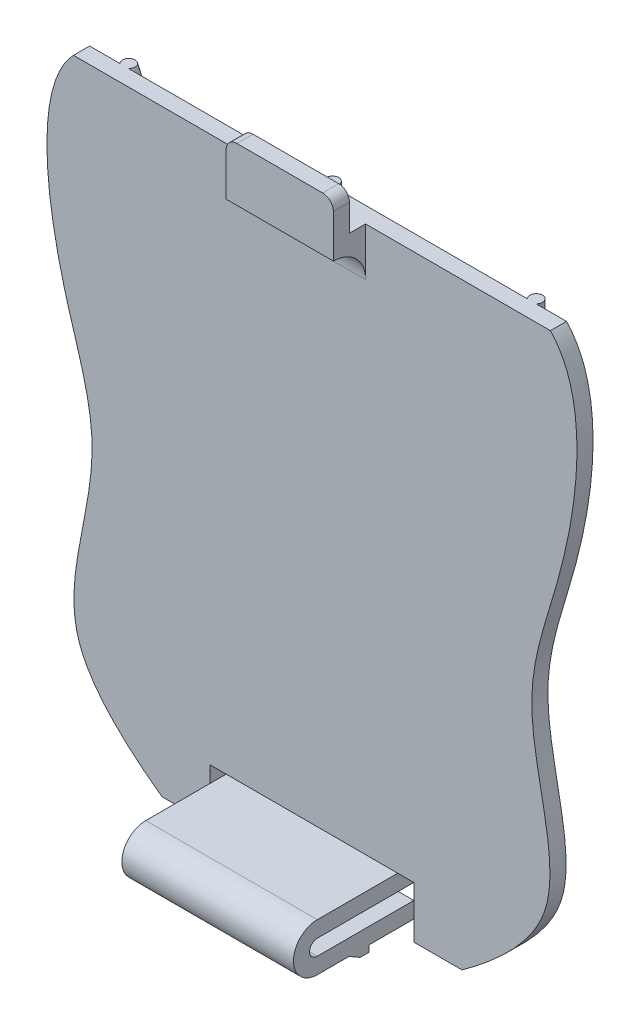
from build123d import *

# Parameters (mm, degrees)
LOW_PLATE_DEPTH     = 1.5
SKETCH3_W           = 19
SKETCH3_H           = 4.817001744
CUT_EXTRUDE1_DEPTH  = 62.000496717
SKETCH5_W           = 9
SKETCH5_H           = 1.5
TONGUE_DEPTH        = 8
TONGUE_BUTTON_DEPTH = 1.5
SKETCH7_W           = 4.5
SKETCH7_H           = 1.5
SKETCH7_W_2         = 1.5
SKETCH7_H_2         = 3.5
BOSS_EXTRUDE4_DEPTH = 5
SKETCH8_W           = 3
SKETCH8_H           = 6.224279684
CUT_EXTRUDE2_DEPTH  = 30
FILLET_START        = -5
FILLET_3MM_DEPTH    = 10
FILLET2_R           = 1
SKETCH9_W           = 0.8
SKETCH9_H           = 0.6
RIGHT_CLIPS_DEPTH   = 2
CLIPS_RIBBS_DEPTH   = 4.5
BOSS_EXTRUDE7_DEPTH = 47
BOSS_EXTRUDE8_DEPTH = 45


with BuildPart() as part:
    # Sketch2 → Low Plate (new body)
    with BuildSketch(Plane.XY):
        with BuildLine():
            Line((-13.987410865, -55.75), (13.987410865, -55.75))
            add(Edge.make_bspline(
                [(13.987410865, -55.75), (15.364516245, -54.752908861), (16.692982198, -53.699471161), (18.526440715, -51.934841851), (19.113479504, -51.311981088), (20.183935625, -49.995249875), (20.669689967, -49.301399402), (21.278190693, -48.174460264), (21.458830968, -47.786634264), (21.758862818, -46.996665666), (21.877700551, -46.592093962), (22.0559056, -45.764663188), (22.116243051, -45.339154605), (22.18748451, -44.490693409), (22.199011375, -44.067536932), (22.180829682, -42.800419677), (22.099164736, -41.95877515), (21.868374402, -40.278493527), (21.718690582, -39.440313431), (21.244394379, -36.929561866), (20.892566631, -35.2590388), (20.577091845, -32.733527124), (20.507236183, -31.888409042), (20.492208023, -30.186585415), (20.552200399, -29.32939987), (20.73057206, -28.035407647), (20.804521311, -27.602881393), (20.974351767, -26.745434183), (21.070391606, -26.319097363), (21.382998298, -25.045340626), (21.623934502, -24.203149153), (22.12390442, -22.522649028), (22.38274515, -21.684298971), (22.877329959, -20.00264347), (23.11123752, -19.158944002), (23.749184146, -16.614162445), (24.099040974, -14.901455558), (24.470243393, -12.299444034), (24.567983481, -11.426529836), (24.695738389, -9.666170984), (24.725628098, -8.777896383), (24.691148458, -7.011699611), (24.627815746, -6.130667368), (24.361532714, -4.37486133), (24.161716694, -3.515589704), (23.779971484, -2.48158604), (23.696844615, -2.27680486), (23.514880537, -1.871923627), (23.415633783, -1.67119118), (23.09590805, -1.087082658), (22.852605055, -0.719048656), (22.29268626, -0.03494376), (21.970988856, 0.282090082), (21.279235232, 0.833537602), (20.908488239, 1.073605964), (20.130319718, 1.501163849), (19.724550492, 1.687333637), (18.906439227, 2.013968076), (18.491193707, 2.15589155), (17.232489601, 2.536842993), (16.376307609, 2.731895799), (14.647046711, 3.063601594), (13.773968133, 3.199405493), (12.024016772, 3.447140862), (11.146413812, 3.558864437), (8.515107441, 3.900980238), (6.762049959, 4.134358142), (4.175193681, 4.681936146), (3.320114283, 4.897770661), (1.63583587, 5.449066892), (0.806320369, 5.783065718), (0, 6.224279684)],
                knots=[0, 0, 0, 0, 0.0625, 0.0625, 0.09375, 0.09375, 0.125, 0.125, 0.140625, 0.140625, 0.15625, 0.15625, 0.171875, 0.171875, 0.1875, 0.1875, 0.21875, 0.21875, 0.25, 0.25, 0.3125, 0.3125, 0.34375, 0.34375, 0.375, 0.375, 0.390625, 0.390625, 0.40625, 0.40625, 0.4375, 0.4375, 0.46875, 0.46875, 0.5, 0.5, 0.5625, 0.5625, 0.59375, 0.59375, 0.625, 0.625, 0.65625, 0.65625, 0.6875, 0.6875, 0.6953125, 0.6953125, 0.703125, 0.703125, 0.71875, 0.71875, 0.734375, 0.734375, 0.75, 0.75, 0.765625, 0.765625, 0.78125, 0.78125, 0.8125, 0.8125, 0.84375, 0.84375, 0.875, 0.875, 0.9375, 0.9375, 0.96875, 0.96875, 1, 1, 1, 1], degree=3))
            add(Edge.make_bspline(
                [(0, 6.224279684), (-0.78781572, 5.793191358), (-1.59969269, 5.463688393), (-3.250288628, 4.918007999), (-4.089304063, 4.70308224), (-6.629712981, 4.156940709), (-8.354084583, 3.922737374), (-11.807066612, 3.47222681), (-13.536628271, 3.263046491), (-16.100537752, 2.790086115), (-16.950076528, 2.605735334), (-18.20851631, 2.246104635), (-18.626112374, 2.111737043), (-19.442777675, 1.806644848), (-19.842917847, 1.635776182), (-20.620162533, 1.242519333), (-21.000449987, 1.017788231), (-21.707807481, 0.508371536), (-22.034629769, 0.223449612), (-22.477316066, -0.257423908), (-22.617930469, -0.427196518), (-22.88094555, -0.778522223), (-23.003096797, -0.959483365), (-23.34478427, -1.516391451), (-23.539706693, -1.906276719), (-23.876874208, -2.715877414), (-24.01675437, -3.130154085), (-24.250726219, -3.965689427), (-24.345271274, -4.388340996), (-24.498951121, -5.241350614), (-24.558027347, -5.671721409), (-24.646972495, -6.538819504), (-24.676663881, -6.974981428), (-24.728611977, -8.275225371), (-24.714946447, -9.137184148), (-24.619449188, -10.854227556), (-24.537274438, -11.709277595), (-24.210555404, -14.266340556), (-23.887407569, -15.960234373), (-23.285495324, -18.489850781), (-23.064178692, -19.331692339), (-22.584933476, -21.012960688), (-22.328473597, -21.85248435), (-21.568336586, -24.371664938), (-21.076070946, -26.052074517), (-20.636971825, -28.592429374), (-20.540245663, -29.442488379), (-20.47902807, -31.15132802), (-20.518239419, -32.010352874), (-20.773645661, -34.596514295), (-21.124722079, -36.332547063), (-21.625125581, -38.934867442), (-21.787706997, -39.802029252), (-22.049361302, -41.532164124), (-22.149215918, -42.396061281), (-22.216131051, -44.124939117), (-22.184303618, -44.989402765), (-21.99208071, -46.070040071), (-21.945610298, -46.286779492), (-21.837202033, -46.711410531), (-21.775071919, -46.920258695), (-21.564469479, -47.536211191), (-21.392786311, -47.933161545), (-20.803562128, -49.091563627), (-20.307916123, -49.825604486), (-19.226630089, -51.186589759), (-18.637007111, -51.821294758), (-17.393865498, -53.030973568), (-16.738818031, -53.606341253), (-15.388299543, -54.710635735), (-14.694077635, -55.238338957), (-13.987410865, -55.75)],
                knots=[0, 0, 0, 0, 0.03125, 0.03125, 0.0625, 0.0625, 0.125, 0.125, 0.1875, 0.1875, 0.21875, 0.21875, 0.234375, 0.234375, 0.25, 0.25, 0.265625, 0.265625, 0.28125, 0.28125, 0.2890625, 0.2890625, 0.296875, 0.296875, 0.3125, 0.3125, 0.328125, 0.328125, 0.34375, 0.34375, 0.359375, 0.359375, 0.375, 0.375, 0.40625, 0.40625, 0.4375, 0.4375, 0.5, 0.5, 0.53125, 0.53125, 0.5625, 0.5625, 0.625, 0.625, 0.65625, 0.65625, 0.6875, 0.6875, 0.75, 0.75, 0.78125, 0.78125, 0.8125, 0.8125, 0.84375, 0.84375, 0.8515625, 0.8515625, 0.859375, 0.859375, 0.875, 0.875, 0.90625, 0.90625, 0.9375, 0.9375, 0.96875, 0.96875, 1, 1, 1, 1], degree=3))
        make_face()
    extrude(amount=LOW_PLATE_DEPTH)

    # Sketch3 → Cut-Extrude1 (cut, through all)
    with BuildSketch(Plane.XY.offset(1.5)):
        with Locations((0, -53.341499128)):
            Rectangle(SKETCH3_W, SKETCH3_H)
    extrude(amount=-CUT_EXTRUDE1_DEPTH, mode=Mode.SUBTRACT)

    # Sketch5 → Tongue (add, symmetric)
    with BuildSketch(Plane(origin=(0, 0, 0), x_dir=(0, 0, -1), z_dir=(1, 0, 0))):
        with Locations((-4.5, -51.682998256)):
            Rectangle(SKETCH5_W, SKETCH5_H)
        with BuildLine():
            ThreePointArc((-9, -52.432998256), (-9.725, -53.157998256), (-9, -53.882998256))
            Line((-9, -53.882998256), (-9, -55.382998256))
            ThreePointArc((-9, -55.382998256), (-11.225, -53.157998256), (-9, -50.932998256))
            Line((-9, -50.932998256), (-9, -52.432998256))
        make_face()
        with Locations((-4.5, -54.632998256)):
            Rectangle(SKETCH5_W, SKETCH5_H)
    extrude(amount=TONGUE_DEPTH, both=True)

    # Sketch6 → Tongue Button (add)
    with BuildSketch(Plane.XZ.offset(55.382998256)):
        with BuildLine():
            Line((-5, 0), (5, 0))
            Line((5, 0), (5, 3.5))
            ThreePointArc((5, 3.5), (4.121320344, 5.621320344), (2, 6.5))
            Line((2, 6.5), (-2, 6.5))
            ThreePointArc((-2, 6.5), (-4.121320344, 5.621320344), (-5, 3.5))
            Line((-5, 3.5), (-5, 0))
        make_face()
    extrude(amount=TONGUE_BUTTON_DEPTH)

    # Sketch7 → Boss-Extrude4 (add, symmetric)
    with BuildSketch(Plane(origin=(0, 0, 0), x_dir=(0, 0, -1), z_dir=(1, 0, 0))):
        with Locations((-2.25, -0.75)):
            Rectangle(SKETCH7_W, SKETCH7_H)
        with Locations((-3.75, 1.75)):
            Rectangle(SKETCH7_W_2, SKETCH7_H_2)
    extrude(amount=BOSS_EXTRUDE4_DEPTH, both=True)

    # Sketch8 → Cut-Extrude2 (cut, symmetric)
    with BuildSketch(Plane(origin=(0, 0, 0), x_dir=(0, 0, -1), z_dir=(1, 0, 0))):
        with Locations((-1.5, 3.112139842)):
            Rectangle(SKETCH8_W, SKETCH8_H)
    extrude(amount=CUT_EXTRUDE2_DEPTH, both=True, mode=Mode.SUBTRACT)

    # Fillet 3mm: read off the stored shape, not the designer's step
    # Fillet 3mm outline → Fillet 3mm (add)
    with BuildSketch(Plane.YZ.offset(FILLET_START)):
        with BuildLine():
            Line((-1.5, 1.5), (-1.5, 4.5))
            ThreePointArc((-1.5, 4.5), (-2.378679656, 2.378679656), (-4.5, 1.5))
            Line((-4.5, 1.5), (-1.5, 1.5))
        make_face()
    extrude(amount=FILLET_3MM_DEPTH)

    # Fillet2
    fillet2_edges = [part.edges().sort_by_distance(p)[0] for p in [
        (-5, 3.5, 3.75),
        (5, 3.5, 3.75),
    ]]
    fillet(fillet2_edges, radius=FILLET2_R)

    # Sketch9 → Right Clips (add)
    with BuildSketch(Plane.ZY.offset(8)):
        Polygon((5, -55.982998256), (6.039230485, -55.382998256), (5, -55.382998256), align=None)
        with Locations((4.6, -55.682998256)):
            Rectangle(SKETCH9_W, SKETCH9_H)
    right_clips = extrude(amount=-RIGHT_CLIPS_DEPTH)

    # Left Clips: Right Clips across plane
    add(right_clips.mirror(Plane(origin=(0, 0, 0), x_dir=(0, 0, 1), z_dir=(1, 0, 0))))

    # Sketch10 → Clips Ribbs (add, symmetric)
    with BuildSketch(Plane(origin=(0, 0, 0), x_dir=(0, 0, -1), z_dir=(1, 0, 0))):
        with BuildLine():
            Line((-0.6, -56.882998256), (0, -56.882998256))
            ThreePointArc((0, -56.882998256), (-0.3, -57.182998256), (-0.6, -56.882998256))
        make_face()
        with BuildLine():
            Line((-1.4, -56.882998256), (-0.8, -56.882998256))
            ThreePointArc((-0.8, -56.882998256), (-1.1, -57.182998256), (-1.4, -56.882998256))
        make_face()
        with BuildLine():
            Line((-2.2, -56.882998256), (-1.6, -56.882998256))
            ThreePointArc((-1.6, -56.882998256), (-1.9, -57.182998256), (-2.2, -56.882998256))
        make_face()
        with BuildLine():
            Line((-3, -56.882998256), (-2.4, -56.882998256))
            ThreePointArc((-2.4, -56.882998256), (-2.7, -57.182998256), (-3, -56.882998256))
        make_face()
        with BuildLine():
            Line((-3.8, -56.882998256), (-3.2, -56.882998256))
            ThreePointArc((-3.2, -56.882998256), (-3.5, -57.182998256), (-3.8, -56.882998256))
        make_face()
        with BuildLine():
            Line((-4.6, -56.882998256), (-4, -56.882998256))
            ThreePointArc((-4, -56.882998256), (-4.3, -57.182998256), (-4.6, -56.882998256))
        make_face()
    extrude(amount=CLIPS_RIBBS_DEPTH, both=True)

    # Sketch11 → Boss-Extrude7 (add)
    with BuildSketch(Plane(origin=(0, 0, 0), x_dir=(1, 0, 0), z_dir=(0, 1, 0))):
        with BuildLine():
            Line((-19.4, 0), (-18.6, 0))
            ThreePointArc((-18.6, 0), (-19, 1), (-19.4, 0))
        make_face()
        with BuildLine():
            Line((-0.4, 0), (0.4, 0))
            ThreePointArc((0.4, 0), (0, 1), (-0.4, 0))
        make_face()
        with BuildLine():
            Line((18.6, 0), (19.4, 0))
            ThreePointArc((19.4, 0), (19, 1), (18.6, 0))
        make_face()
    extrude(amount=-BOSS_EXTRUDE7_DEPTH)

    # Sketch11<2> → Boss-Extrude8 (add, along a direction that is not the sketch's normal)
    with BuildSketch(Plane(origin=(0, 0, 0), x_dir=(1, 0, 0), z_dir=(0, 1, 0))):
        with BuildLine():
            Line((18.6, 0), (19.4, 0))
            ThreePointArc((19.4, 0), (19, 1), (18.6, 0))
        make_face()
    boss_extrude8 = extrude(amount=-BOSS_EXTRUDE8_DEPTH, dir=(0.4198978370787637, 0.9075713781386983, 0))

    # Mirror2: Boss-Extrude8 across plane
    add(boss_extrude8.mirror(Plane(origin=(0, 0, 0), x_dir=(0, 0, 1), z_dir=(1, 0, 0))))


solid = part.part
